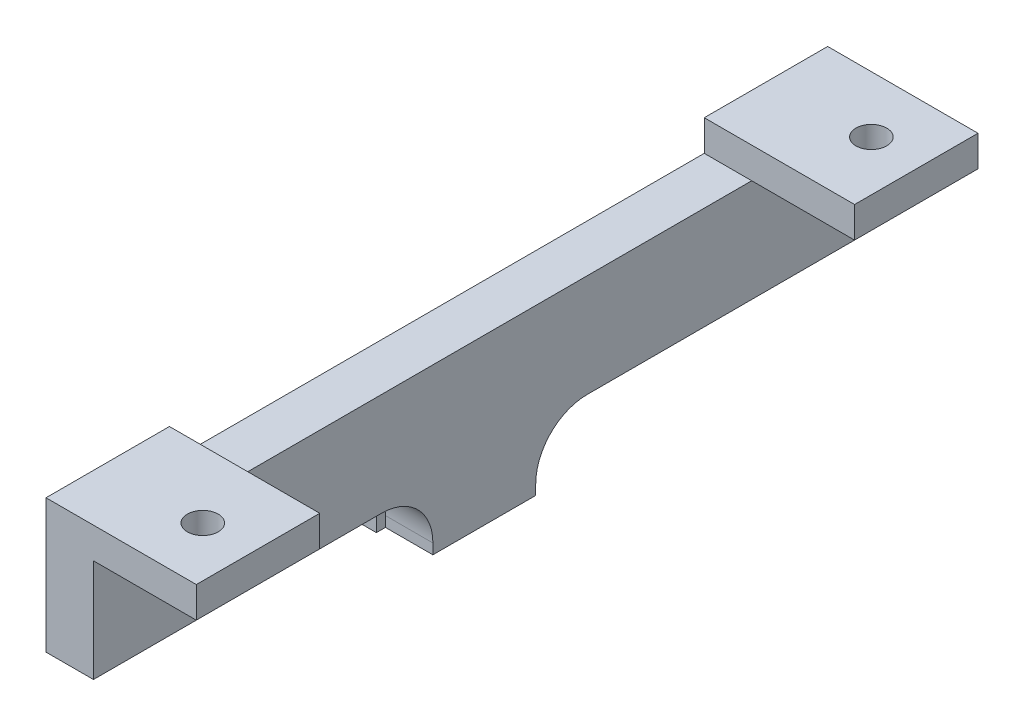
from build123d import *

# Parameters (mm, degrees)
SKETCH1_R           = 1.5
BOSS_EXTRUDE1_DEPTH = 3
SKETCH3_W           = 4.615398666
SKETCH3_H           = 10
BOSS_EXTRUDE2_DEPTH = 12.9997796
FILLET7_R           = 1
CUT_EXTRUDE4_DEPTH  = 10
FILLET8_R           = 4
SKETCH8_W           = 76
SKETCH8_H           = 10
BOSS_EXTRUDE3_DEPTH = 4.615398666
SKETCH9_W           = 14.615398666
SKETCH9_H           = 12
SKETCH9_R           = 1.5
BOSS_EXTRUDE4_DEPTH = 3
FILLET9_R           = 5
FILLET10_R          = 5
SKETCH10_W          = 9.773230982
SKETCH10_H          = 9.985016007
SKETCH10_W_2        = 12.713773796
SKETCH10_H_2        = 7.76031956
CUT_EXTRUDE6_DEPTH  = 10


with BuildPart() as part:
    # Sketch1 → Boss-Extrude1 (new body)
    with BuildSketch(Plane(origin=(0, 0, 0), x_dir=(1, 0, 0), z_dir=(0, 1, 0))):
        Polygon((-3, -11.32792047), (3, -11.32792047), (3, -5), (7.615398666, -5), (7.615398666, 5), (3, 5), (3, 11.32792047), (-3, 11.32792047), align=None)
        with Locations(Location((0, 8.5, 0), (0, 0, 270))):
            Circle(SKETCH1_R, mode=Mode.SUBTRACT)
        with Locations(Location((0, -8.5, 0), (0, 0, 270))):
            Circle(SKETCH1_R, mode=Mode.SUBTRACT)
    extrude(amount=BOSS_EXTRUDE1_DEPTH)

    # Sketch3 → Boss-Extrude2 (add)
    with BuildSketch(Plane(origin=(0, 3, 0), x_dir=(1, 0, 0), z_dir=(0, 1, 0))):
        with Locations((5.307699333, 0)):
            Rectangle(SKETCH3_W, SKETCH3_H)
    extrude(amount=BOSS_EXTRUDE2_DEPTH)

    # Fillet7
    fillet7_edges = [part.edges().sort_by_distance(p)[0] for p in [
        (3, 1.5, 11.32792047),
        (3, 1.5, -11.32792047),
    ]]
    fillet(fillet7_edges, radius=FILLET7_R)

    # Sketch7 → Cut-Extrude4 (cut)
    with BuildSketch(Plane.XZ):
        with BuildLine():
            Line((-3.65526474, -6.392053518), (-3.78188192, 6.478485425))
            ThreePointArc((-3.78188192, 6.478485425), (-0.319780446, 0.076652438), (-3.65526474, -6.392053518))
        make_face()
    extrude(amount=-CUT_EXTRUDE4_DEPTH, mode=Mode.SUBTRACT)

    # Fillet8
    fillet8_edges = [part.edges().sort_by_distance(p)[0] for p in [
        (3, 3, 0),
    ]]
    fillet(fillet8_edges, radius=FILLET8_R)

    # Sketch8 → Boss-Extrude3 (add)
    with BuildSketch(Plane(origin=(7.615398666, 0, 0), x_dir=(0, 0, -1), z_dir=(1, 0, 0))):
        with Locations((0, 10.9997796)):
            Rectangle(SKETCH8_W, SKETCH8_H)
    extrude(amount=-BOSS_EXTRUDE3_DEPTH)

    # Sketch9 → Boss-Extrude4 (add)
    # profile 1 of 2: a face of its own
    with BuildSketch(Plane(origin=(0, 15.9997796, 0), x_dir=(1, 0, 0), z_dir=(0, 1, 0))):
        with Locations((10.307699333, 32)):
            Rectangle(SKETCH9_W, SKETCH9_H)
        with Locations(Location((12.745112207, 32.5, 0), (0, 0, 270))):
            Circle(SKETCH9_R, mode=Mode.SUBTRACT)
    # profile 2 of 2: a face of its own
    with BuildSketch(Plane(origin=(0, 15.9997796, 0), x_dir=(1, 0, 0), z_dir=(0, 1, 0))):
        with Locations((10.307699333, -32)):
            Rectangle(SKETCH9_W, SKETCH9_H)
        with Locations(Location((12.745112207, -32.5, 0), (0, 0, 270))):
            Circle(SKETCH9_R, mode=Mode.SUBTRACT)
    extrude(amount=BOSS_EXTRUDE4_DEPTH)

    # Fillet9
    # the kernel refuses this fillet: 5 mm, written as the material it adds along each edge
    with BuildSketch(Plane(origin=(7.615398666, 5.9997796, 5), x_dir=(0, -1, 0), z_dir=(-1, 0, 0))) as fillet9_piece_1:
        with BuildLine():
            CenterArc((FILLET9_R, FILLET9_R), FILLET9_R, 180, 90)
            Line((0, FILLET9_R), (0, 0))
            Line((0, 0), (FILLET9_R, 0))
        make_face()
    extrude(amount=4.615398666)

    # Fillet10
    # the kernel refuses this fillet: 5 mm, written as the material it adds along each edge
    with BuildSketch(Plane(origin=(3, 5.9997796, -5), x_dir=(0, -1, 0), z_dir=(1, 0, 0))) as fillet10_piece_1:
        with BuildLine():
            CenterArc((FILLET10_R, FILLET10_R), FILLET10_R, 180, 90)
            Line((0, FILLET10_R), (0, 0))
            Line((0, 0), (FILLET10_R, 0))
        make_face()
    extrude(amount=4.615398666)

    # Sketch10 → Cut-Extrude6 (cut)
    with BuildSketch(Plane(origin=(0, 3, 0), x_dir=(1, 0, 0), z_dir=(0, 1, 0))):
        with Locations((-1.330252474, 10.872508004)):
            Rectangle(SKETCH10_W, SKETCH10_H)
        with Locations((-2.800523881, -9.76015978)):
            Rectangle(SKETCH10_W_2, SKETCH10_H_2)
    extrude(amount=-CUT_EXTRUDE6_DEPTH, mode=Mode.SUBTRACT)


solid = part.part
